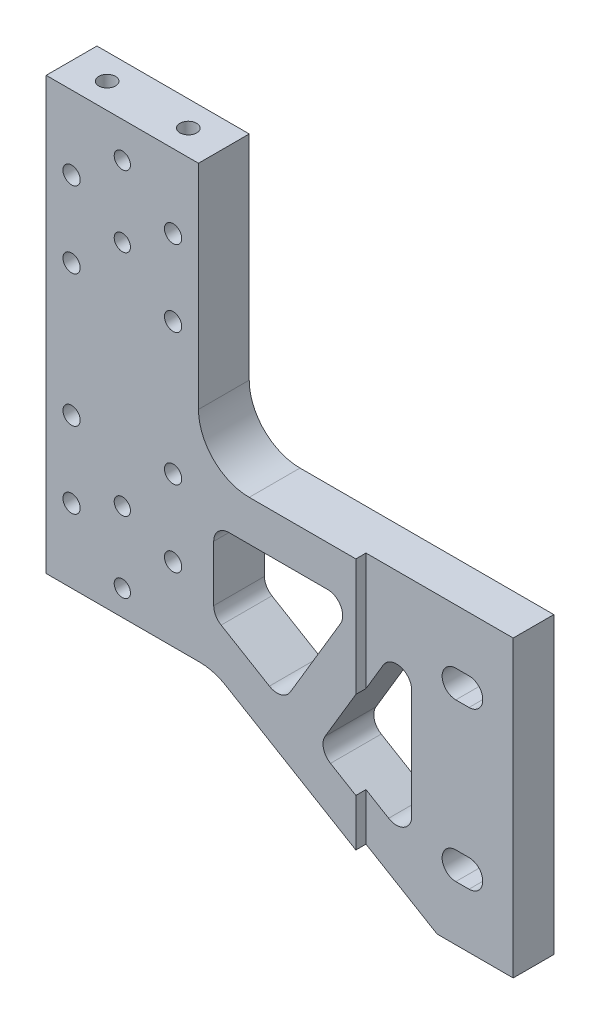
from build123d import *

# Parameters (mm, degrees)
AUFSATZ_LINEAR_AUSTRAGEN1_DEPTH                      = 10
F_5_4_5_4_DURCHMESSER_LANGLOCH4_DEPTH                = 10
SCHNITT_LINEAR_AUSTRAGEN1_DEPTH                      = 94.789655764
VERRUNDUNG1_R                                        = 3
M4_GEWINDEBOHRUNG2_D                                 = 3.3
M4_GEWINDEBOHRUNG2_DEPTH                             = 11.5
M4_GEWINDEBOHRUNG2_TIP                               = 0.991420021
FORMSENKUNG_F_R_M3_SENKSCHRAUBE_MIT_SCHL_D           = 3.2
FORMSENKUNG_F_R_M3_SENKSCHRAUBE_MIT_SCHL_CSINK_D     = 6.3
FORMSENKUNG_F_R_M3_SENKSCHRAUBE_MIT_SCHL_CSINK_ANGLE = 90
M4_GEWINDEBOHRUNG1_D                                 = 3.3
M4_GEWINDEBOHRUNG1_DEPTH                             = 11.5
M4_GEWINDEBOHRUNG1_TIP                               = 0.991420021
VERRUNDUNG2_R                                        = 10
SKIZZE13_W                                           = 29
SKIZZE13_H                                           = 58
SCHNITT_LINEAR_AUSTRAGEN2_DEPTH                      = 2
FORMSENKUNG_F_R_M3_LINSENSENKSCHRAUBE_MI_D           = 3.4
FORMSENKUNG_F_R_M3_LINSENSENKSCHRAUBE_MI_CSINK_D     = 6.3
FORMSENKUNG_F_R_M3_LINSENSENKSCHRAUBE_MI_CSINK_ANGLE = 90
M4_GEWINDEBOHRUNG3_D                                 = 3.3
M4_GEWINDEBOHRUNG3_DEPTH                             = 11.5
M4_GEWINDEBOHRUNG3_CSINK_D                           = 4.05
M4_GEWINDEBOHRUNG3_CSINK_ANGLE                       = 90
M4_GEWINDEBOHRUNG3_TIP                               = 0.991420021


# Read off the part's stored shape, not the designer's step: Ø5.4 (5.4) Durchmesser Langloch4
with BuildPart() as part:
    # Skizze1 → Aufsatz-Linear austragen1 (new body)
    with BuildSketch(Plane.XY):
        Polygon((28.788534666, -29), (-13.211465334, -4), (-46.211465334, -4), (-46.211465334, 81), (-16.211465334, 81), (-16.211465334, 29), (43.788534666, 29), (43.788534666, -29), align=None)
    extrude(amount=AUFSATZ_LINEAR_AUSTRAGEN1_DEPTH)

    # Ø5.4 (5.4) Durchmesser Langloch4 outline → Ø5.4 (5.4) Durchmesser Langloch4 (cut)
    with BuildSketch(Plane.XY):
        with BuildLine():
            Line((32.488534666, -18.2), (35.088534666, -18.2))
            ThreePointArc((35.088534666, -18.2), (37.788534666, -15.5), (35.088534666, -12.8))
            Line((35.088534666, -12.8), (32.488534666, -12.8))
            ThreePointArc((32.488534666, -12.8), (29.788534666, -15.5), (32.488534666, -18.2))
        make_face()
        with BuildLine():
            Line((32.488534666, 12.8), (35.088534666, 12.8))
            ThreePointArc((35.088534666, 12.8), (37.788534666, 15.5), (35.088534666, 18.2))
            Line((35.088534666, 18.2), (32.488534666, 18.2))
            ThreePointArc((32.488534666, 18.2), (29.788534666, 15.5), (32.488534666, 12.8))
        make_face()
    extrude(amount=F_5_4_5_4_DURCHMESSER_LANGLOCH4_DEPTH, mode=Mode.SUBTRACT)

    # Skizze5 → Schnitt-Linear austragen1 (cut, through all)
    with BuildSketch(Plane(origin=(0, 0, 0), x_dir=(-1, 0, 0), z_dir=(0, 0, -1))):
        Polygon((-23.788534666, -16.713829021), (-23.788534666, 21), (-7.212762179, -6.847297779), align=None)
        Polygon((13.211465334, 21), (13.211465334, 5.309980503), (-0.338419104, -2.7554269), (-14.478554163, 21), align=None)
    extrude(amount=-SCHNITT_LINEAR_AUSTRAGEN1_DEPTH, mode=Mode.SUBTRACT)

    # Verrundung1
    verrundung1_edges = [part.edges().sort_by_distance(p)[0] for p in [
        (7.212762179, -6.847297779, 5),
        (23.788534666, -16.713829021, 5),
        (23.788534666, 21, 5),
        (0.338419104, -2.7554269, 5),
        (14.478554163, 21, 5),
        (-13.211465334, 21, 5),
        (-13.211465334, 5.309980503, 5),
    ]]
    fillet(verrundung1_edges, radius=VERRUNDUNG1_R)

    # M4 Gewindebohrung2
    with Locations(Plane(origin=(0, -4, 0), x_dir=(-1, 0, 0), z_dir=(0, -1, 0))):
        with Locations((23.211465334, -5), (39.211465334, -5)):
            Hole(M4_GEWINDEBOHRUNG2_D / 2, depth=M4_GEWINDEBOHRUNG2_DEPTH)
            with Locations((0, 0, -(M4_GEWINDEBOHRUNG2_DEPTH + M4_GEWINDEBOHRUNG2_TIP / 2))):  # 118° drill point
                Cone(0, M4_GEWINDEBOHRUNG2_D / 2, M4_GEWINDEBOHRUNG2_TIP, mode=Mode.SUBTRACT)

    # Formsenkung für M3 Senkschraube mit Schlitz/Kreuzschlitz1 (through all)
    with Locations(Plane(origin=(0, 0, 0), x_dir=(1, 0, 0), z_dir=(0, 0, -1))):
        with Locations((-31.211465334, -15), (-31.211465334, -1), (-31.211465334, -74), (-31.211465334, -60)):
            CounterSinkHole(FORMSENKUNG_F_R_M3_SENKSCHRAUBE_MIT_SCHL_D / 2, FORMSENKUNG_F_R_M3_SENKSCHRAUBE_MIT_SCHL_CSINK_D / 2, counter_sink_angle=FORMSENKUNG_F_R_M3_SENKSCHRAUBE_MIT_SCHL_CSINK_ANGLE)

    # M4 Gewindebohrung1
    with Locations(Plane(origin=(0, 81, 0), x_dir=(1, 0, 0), z_dir=(0, 1, 0))):
        with Locations((-39.211465334, -5), (-23.211465334, -5)):
            Hole(M4_GEWINDEBOHRUNG1_D / 2, depth=M4_GEWINDEBOHRUNG1_DEPTH)
            with Locations((0, 0, -(M4_GEWINDEBOHRUNG1_DEPTH + M4_GEWINDEBOHRUNG1_TIP / 2))):  # 118° drill point
                Cone(0, M4_GEWINDEBOHRUNG1_D / 2, M4_GEWINDEBOHRUNG1_TIP, mode=Mode.SUBTRACT)

    # Verrundung2
    verrundung2_edges = [part.edges().sort_by_distance(p)[0] for p in [
        (-13.211465334, -4, 5),
        (-16.211465334, 29, 5),
    ]]
    fillet(verrundung2_edges, radius=VERRUNDUNG2_R)

    # Skizze13 → Schnitt-Linear austragen2 (cut)
    with BuildSketch(Plane.XY.offset(10)):
        with Locations((29.288534666, 0)):
            Rectangle(SKIZZE13_W, SKIZZE13_H)
    extrude(amount=-SCHNITT_LINEAR_AUSTRAGEN2_DEPTH, mode=Mode.SUBTRACT)

    # Formsenkung für M3 Linsensenkschraube mit Schlitz1 (through all)
    with Locations(Plane(origin=(0, 0, 0), x_dir=(-1, 0, 0), z_dir=(0, 0, -1))):
        with Locations((21.211465334, 66.5), (21.211465334, 51.5), (41.211465334, 66.5), (41.211465334, 51.5), (21.211465334, 25.5), (21.211465334, 10.5), (41.211465334, 25.5), (41.211465334, 10.5)):
            CounterSinkHole(FORMSENKUNG_F_R_M3_LINSENSENKSCHRAUBE_MI_D / 2, FORMSENKUNG_F_R_M3_LINSENSENKSCHRAUBE_MI_CSINK_D / 2, counter_sink_angle=FORMSENKUNG_F_R_M3_LINSENSENKSCHRAUBE_MI_CSINK_ANGLE)

    # M4 Gewindebohrung3
    with Locations(Plane.ZY.offset(46.211465334)):
        with Locations((5, 39), (5, 18), (5, 60)):
            CounterSinkHole(M4_GEWINDEBOHRUNG3_D / 2, M4_GEWINDEBOHRUNG3_CSINK_D / 2, depth=M4_GEWINDEBOHRUNG3_DEPTH, counter_sink_angle=M4_GEWINDEBOHRUNG3_CSINK_ANGLE)
            with Locations((0, 0, -(M4_GEWINDEBOHRUNG3_DEPTH + M4_GEWINDEBOHRUNG3_TIP / 2))):  # 118° drill point
                Cone(0, M4_GEWINDEBOHRUNG3_D / 2, M4_GEWINDEBOHRUNG3_TIP, mode=Mode.SUBTRACT)


solid = part.part
